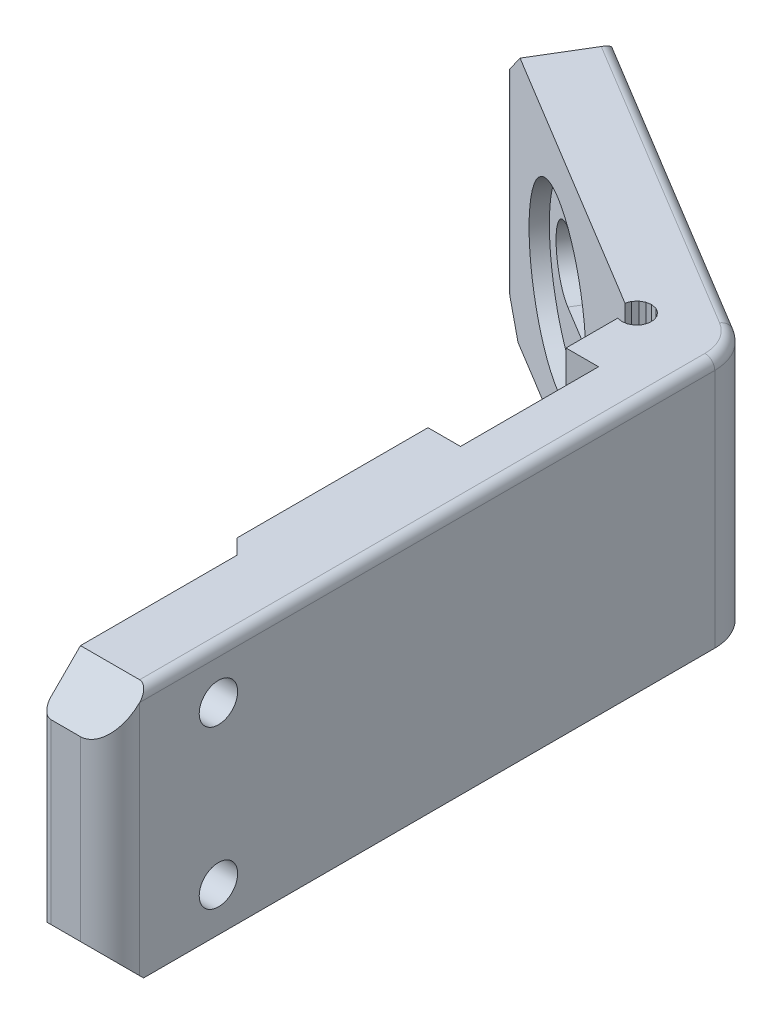
from build123d import *

# Parameters (mm, degrees)
LEG_AND_PAD_DEPTH          = 13
SCREW_HEAD_RELIEF_SKETCH_W = 14
SCREW_HEAD_RELIEF_SKETCH_H = 6
SCREW_HEAD_RELIEF_DEPTH    = 2.35
M6_SLOT_MIDDLE_DEPTH       = 3.5
SCREW_HOLES_SKETCH_R       = 1.95
SCREW_HOLES_DEPTH          = 4.5
LEG_TOP_CORNERS_SIZE       = 4
PAD_END_CORNERS_SIZE       = 4
OUTSIDE_OF_THE_BEND_R      = 5
LEG_TOP_OUTER_EDGE_R       = 3
PAD_END_OUTER_EDGE_R       = 3
LEG_TOP_INNER_EDGE_R       = 1
PAD_END_INNER_EDGE_R       = 1
BED_FACE_CHAMFER_SIZE      = 0.6
TOP_FACE_EDGE_R            = 1


with BuildPart() as part:
    # leg and pad sketch → leg and pad (new, symmetric)
    with BuildSketch(Plane(origin=(0, -20.7, 0), x_dir=(1, 0, 0), z_dir=(0, 1, 0))):
        Polygon((-0.551289683, 30.332713936), (-0.367250577, 30.819395741), (-0.028023026, 31.213926146), (0.425575667, 31.468833575), (0.938966578, 31.553446481), (1.450376329, 31.457583879), (1.898269923, 31.192780366), (2.228754897, 30.790898227), (2.402065893, 30.30029363), (2.397349395, 29.779998208), (2.215172912, 29.292616119), (1.877456693, 28.896791249), (1.424836191, 28.640150931), (0.91177263, 28.55357522), (0.4, 28.647481273), (0.4, -9.98), (1.92, -11.5), (1.92, -31.37), (8.92, -31.37), (8.92, 32.792642706), (-27.204821487, 54.594667874), (-30.821788068, 48.601542416), align=None)
    extrude(amount=LEG_AND_PAD_DEPTH, both=True)

    # screw head relief sketch → screw head relief (cut, symmetric)
    with BuildSketch(Plane(origin=(1.35, 0, 0), x_dir=(0, 0, -1), z_dir=(1, 0, 0))):
        with Locations((16.4, -9.7)):
            Rectangle(SCREW_HEAD_RELIEF_SKETCH_W, SCREW_HEAD_RELIEF_SKETCH_H)
    extrude(amount=SCREW_HEAD_RELIEF_DEPTH, both=True, mode=Mode.SUBTRACT)

    # insert flange relief sketch → insert flange relief (revolve, cut)
    with BuildSketch(Plane(origin=(0, -20.7, 0), x_dir=(1, 0, 0), z_dir=(0, 1, 0))):
        Polygon((-18.324853729, 39.891397061), (-17.03307995, 42.03179901), (-9.755713323, 37.639768162), (-11.047487102, 35.499366213), align=None)
    revolve(axis=Axis((-18.324853729, -20.7, -39.891397061), (0.5167095115681243, 0, -0.8561607796757748)), mode=Mode.SUBTRACT)

    # M6 slot end 1 sketch → M6 slot end 1 (revolve, cut)
    with BuildSketch(Plane(origin=(0, -20.7, 0), x_dir=(1, 0, 0), z_dir=(0, 1, 0))):
        Polygon((-20.893336068, 41.441525596), (-16.242950464, 49.146972613), (-13.246387735, 47.338489322), (-17.896773339, 39.633042305), align=None)
    revolve(axis=Axis((-20.893336068, -20.7, -41.441525596), (0.5167095115681233, 0, -0.8561607796757753)), mode=Mode.SUBTRACT)

    # M6 slot end 2 sketch → M6 slot end 2 (revolve, cut)
    with BuildSketch(Plane(origin=(0, -20.7, 0), x_dir=(1, 0, 0), z_dir=(0, 1, 0))):
        Polygon((-15.75637139, 38.341268526), (-11.105985786, 46.046715543), (-8.109423057, 44.238232253), (-12.759808661, 36.532785236), align=None)
    revolve(axis=Axis((-15.75637139, -20.7, -38.341268526), (0.5167095115681234, 0, -0.8561607796757752)), mode=Mode.SUBTRACT)

    # M6 slot middle sketch → M6 slot middle (cut, symmetric)
    with BuildSketch(Plane(origin=(0, -20.7, 0), x_dir=(1, 0, 0), z_dir=(0, 1, 0))):
        Polygon((-15.75637139, 38.341268526), (-20.893336068, 41.441525596), (-16.242950464, 49.146972613), (-11.105985786, 46.046715543), align=None)
    extrude(amount=M6_SLOT_MIDDLE_DEPTH, both=True, mode=Mode.SUBTRACT)

    # screw holes sketch → screw holes (cut, symmetric)
    with BuildSketch(Plane(origin=(5.42, 0, 0), x_dir=(0, 0, -1), z_dir=(1, 0, 0))):
        with Locations((-20.375, -28.7)):
            Circle(SCREW_HOLES_SKETCH_R)
        with Locations((-20.375, -12.7)):
            Circle(SCREW_HOLES_SKETCH_R)
    extrude(amount=SCREW_HOLES_DEPTH, both=True, mode=Mode.SUBTRACT)

    # leg top corners
    leg_top_corners_edges = [part.edges().sort_by_distance(p)[0] for p in [
        (5.42, -7.7, 31.37),
        (5.42, -33.7, 31.37),
    ]]
    chamfer(leg_top_corners_edges, length=LEG_TOP_CORNERS_SIZE)

    # pad end corners
    pad_end_corners_edges = [part.edges().sort_by_distance(p)[0] for p in [
        (-29.013304778, -7.7, -51.598105145),
        (-29.013304778, -33.7, -51.598105145),
    ]]
    chamfer(pad_end_corners_edges, length=PAD_END_CORNERS_SIZE)

    # outside of the bend
    outside_of_the_bend_edges = [part.edges().sort_by_distance(p)[0] for p in [
        (8.92, -20.7, -32.792642706),
    ]]
    fillet(outside_of_the_bend_edges, radius=OUTSIDE_OF_THE_BEND_R)

    # leg top outer edge
    leg_top_outer_edge_edges = [part.edges().sort_by_distance(p)[0] for p in [
        (8.92, -20.7, 31.37),
    ]]
    fillet(leg_top_outer_edge_edges, radius=LEG_TOP_OUTER_EDGE_R)

    # pad end outer edge
    pad_end_outer_edge_edges = [part.edges().sort_by_distance(p)[0] for p in [
        (-27.204821487, -20.7, -54.594667874),
    ]]
    fillet(pad_end_outer_edge_edges, radius=PAD_END_OUTER_EDGE_R)

    # leg top inner edge
    leg_top_inner_edge_edges = [part.edges().sort_by_distance(p)[0] for p in [
        (1.92, -20.7, 31.37),
    ]]
    fillet(leg_top_inner_edge_edges, radius=LEG_TOP_INNER_EDGE_R)

    # pad end inner edge
    pad_end_inner_edge_edges = [part.edges().sort_by_distance(p)[0] for p in [
        (-30.821788068, -20.7, -48.601542416),
    ]]
    fillet(pad_end_inner_edge_edges, radius=PAD_END_INNER_EDGE_R)

    # bed face chamfer
    bed_face_chamfer_edges = [part.edges().sort_by_distance(p)[0] for p in [
        (-13.974217317, -33.7, -38.433709153),
        (-8.638315405, -33.7, -43.38942405),
        (1.92, -33.7, 19.435),
        (0.4, -33.7, -9.333740636),
        (8.274178326, -33.7, -32.428085628),
        (8.92, -33.7, -1.300107187),
    ]]
    chamfer(bed_face_chamfer_edges, length=BED_FACE_CHAMFER_SIZE)

    # top face edge
    top_face_edge_edges = [part.edges().sort_by_distance(p)[0] for p in [
        (-8.638315405, -7.7, -43.38942405),
        (8.274178326, -7.7, -32.428085628),
        (8.92, -7.7, -1.300107187),
    ]]
    fillet(top_face_edge_edges, radius=TOP_FACE_EDGE_R)


solid = part.part
